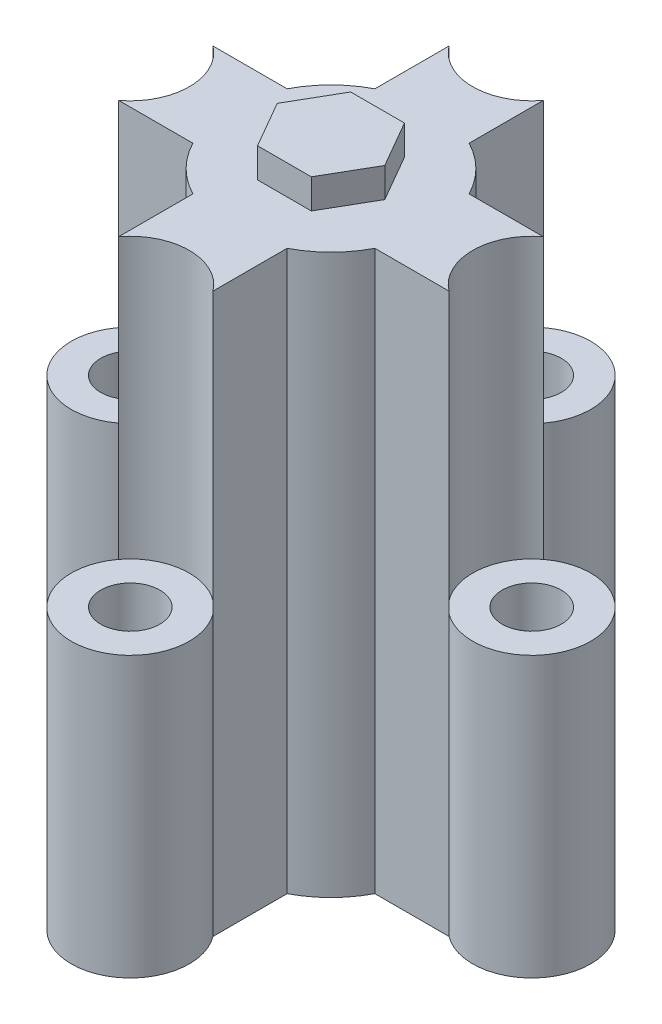
from build123d import *

# Parameters (mm, degrees)
BOSS_EXTRUDE1_DEPTH = 60
SKETCH1_3_R         = 6.339
SKETCH1_3_R_2       = 3.175
BOSS_EXTRUDE2_DEPTH = 30
BOSS_EXTRUDE3_DEPTH = 3.175


with BuildPart() as part:
    # Sketch1 → Boss-Extrude1 (new body)
    with BuildSketch(Plane(origin=(0, 0, 0), x_dir=(1, 0, 0), z_dir=(0, 1, 0))):
        with BuildLine():
            ThreePointArc((17.727459811, -5.058299483), (15.209, 0), (17.727459811, 5.058299483))
            Line((17.727459811, 5.058299483), (9.767988858, 5.058299483))
            ThreePointArc((9.767988858, 5.058299483), (7.778174593, 7.778174593), (5.058299483, 9.767988858))
            Line((5.058299483, 9.767988858), (5.058299483, 17.727459811))
            ThreePointArc((5.058299483, 17.727459811), (0, 15.209), (-5.058299483, 17.727459811))
            Line((-5.058299483, 17.727459811), (-5.058299483, 9.767988858))
            ThreePointArc((-5.058299483, 9.767988858), (-7.778174593, 7.778174593), (-9.767988858, 5.058299483))
            Line((-9.767988858, 5.058299483), (-17.727459811, 5.058299483))
            ThreePointArc((-17.727459811, 5.058299483), (-15.209, 0), (-17.727459811, -5.058299483))
            Line((-17.727459811, -5.058299483), (-9.767988858, -5.058299483))
            ThreePointArc((-9.767988858, -5.058299483), (-7.778174593, -7.778174593), (-5.058299483, -9.767988858))
            Line((-5.058299483, -9.767988858), (-5.058299483, -17.727459811))
            ThreePointArc((-5.058299483, -17.727459811), (0, -15.209), (5.058299483, -17.727459811))
            Line((5.058299483, -17.727459811), (5.058299483, -9.767988858))
            ThreePointArc((5.058299483, -9.767988858), (7.778174593, -7.778174593), (9.767988858, -5.058299483))
            Line((9.767988858, -5.058299483), (17.727459811, -5.058299483))
        make_face()
    extrude(amount=BOSS_EXTRUDE1_DEPTH)

    # Sketch1<3> → Boss-Extrude2 (add)
    # profile 1 of 4: a face of its own
    with BuildSketch(Plane(origin=(0, 0, 0), x_dir=(1, 0, 0), z_dir=(0, 1, 0))):
        with Locations((21.548, 0)):
            Circle(SKETCH1_3_R)
        with Locations((21.548, 0)):
            Circle(SKETCH1_3_R_2, mode=Mode.SUBTRACT)
    # profile 2 of 4: a face of its own
    with BuildSketch(Plane(origin=(0, 0, 0), x_dir=(1, 0, 0), z_dir=(0, 1, 0))):
        with Locations((0, 21.548)):
            Circle(SKETCH1_3_R)
        with Locations((0, 21.548)):
            Circle(SKETCH1_3_R_2, mode=Mode.SUBTRACT)
    # profile 3 of 4: a face of its own
    with BuildSketch(Plane(origin=(0, 0, 0), x_dir=(1, 0, 0), z_dir=(0, 1, 0))):
        with Locations((0, -21.548)):
            Circle(SKETCH1_3_R)
        with Locations((0, -21.548)):
            Circle(SKETCH1_3_R_2, mode=Mode.SUBTRACT)
    # profile 4 of 4: a face of its own
    with BuildSketch(Plane(origin=(0, 0, 0), x_dir=(1, 0, 0), z_dir=(0, 1, 0))):
        with Locations((-21.548, 0)):
            Circle(SKETCH1_3_R)
        with Locations((-21.548, 0)):
            Circle(SKETCH1_3_R_2, mode=Mode.SUBTRACT)
    extrude(amount=BOSS_EXTRUDE2_DEPTH)

    # Sketch2 → Boss-Extrude3 (add)
    with BuildSketch(Plane(origin=(0, 60, 0), x_dir=(1, 0, 0), z_dir=(0, 1, 0))):
        Polygon((5.773502692, 0), (2.886751346, 5), (-2.886751346, 5), (-5.773502692, 0), (-2.886751346, -5), (2.886751346, -5), align=None)
    extrude(amount=BOSS_EXTRUDE3_DEPTH)


solid = part.part
